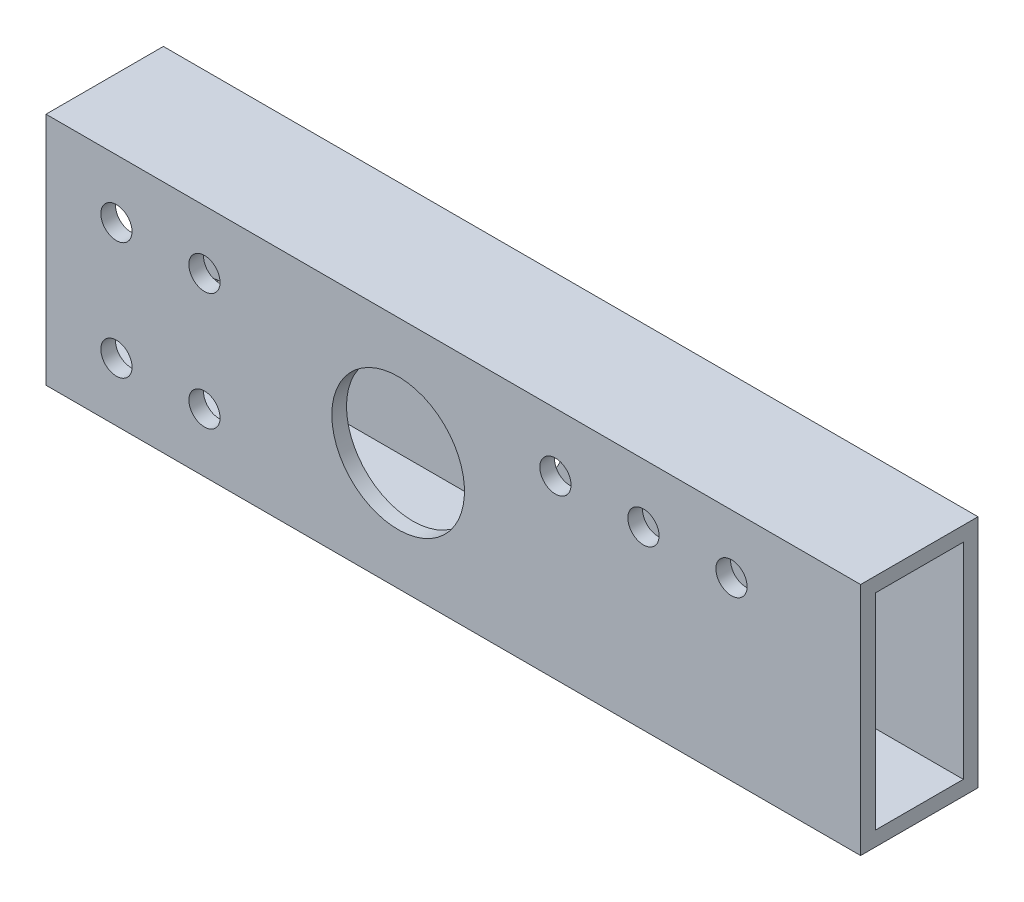
from build123d import *

# Parameters (mm, degrees)
SKETCH1_W           = 176.276
SKETCH1_H           = 25.4
BOSS_EXTRUDE1_DEPTH = 50.8
SKETCH2_OUTSIDE_W   = 64.44
SKETCH2_OUTSIDE_H   = 89.84
SKETCH2_OUTSIDE_W_2 = 25.4
SKETCH2_OUTSIDE_H_2 = 50.8
SKETCH2_OUTSIDE_W_3 = 19.05
SKETCH2_OUTSIDE_H_3 = 44.45
CUT_EXTRUDE1_DEPTH  = 186.199968078
SKETCH3_R           = 14.351
CUT_EXTRUDE2_DEPTH  = 186.199968078
SKETCH4_R           = 3.3782
CUT_EXTRUDE3_DEPTH  = 186.199968078
SKETCH5_R           = 3.3782
CUT_EXTRUDE4_DEPTH  = 186.199968078


with BuildPart() as part:
    # Sketch1 → Boss-Extrude1 (new body)
    with BuildSketch(Plane(origin=(0, 0, 0), x_dir=(1, 0, 0), z_dir=(0, 1, 0))):
        with Locations((88.138, 12.7)):
            Rectangle(SKETCH1_W, SKETCH1_H)
    extrude(amount=BOSS_EXTRUDE1_DEPTH)

    # Sketch2 outside → Cut-Extrude1 (cut, through all)
    # profile 1 of 2: a face of its own
    with BuildSketch(Plane(origin=(176.276, 0, 0), x_dir=(0, 0, -1), z_dir=(1, 0, 0))):
        with Locations((12.7, 25.4)):
            Rectangle(SKETCH2_OUTSIDE_W, SKETCH2_OUTSIDE_H)
        with Locations((12.7, 25.4)):
            Rectangle(SKETCH2_OUTSIDE_W_2, SKETCH2_OUTSIDE_H_2, mode=Mode.SUBTRACT)
    # profile 2 of 2: a face of its own
    with BuildSketch(Plane(origin=(176.276, 0, 0), x_dir=(0, 0, -1), z_dir=(1, 0, 0))):
        with Locations((12.7, 25.4)):
            Rectangle(SKETCH2_OUTSIDE_W_3, SKETCH2_OUTSIDE_H_3)
    extrude(amount=-CUT_EXTRUDE1_DEPTH, mode=Mode.SUBTRACT)

    # Sketch3 → Cut-Extrude2 (cut, through all)
    with BuildSketch(Plane(origin=(0, 0, -25.4), x_dir=(-1, 0, 0), z_dir=(0, 0, -1))):
        with Locations((-76.2, 25.4)):
            Circle(SKETCH3_R)
    extrude(amount=-CUT_EXTRUDE2_DEPTH, mode=Mode.SUBTRACT)

    # Sketch4 → Cut-Extrude3 (cut, through all)
    with BuildSketch(Plane.XY):
        with Locations((148.336, 38.1)):
            Circle(SKETCH4_R)
        with Locations((129.286, 38.1)):
            Circle(SKETCH4_R)
        with Locations((110.236, 38.1)):
            Circle(SKETCH4_R)
    extrude(amount=-CUT_EXTRUDE3_DEPTH, mode=Mode.SUBTRACT)

    # Sketch5 → Cut-Extrude4 (cut, through all)
    with BuildSketch(Plane.XY):
        with Locations((15.24, 38.1)):
            Circle(SKETCH5_R)
        with Locations((15.24, 12.7)):
            Circle(SKETCH5_R)
        with Locations((34.29, 12.7)):
            Circle(SKETCH5_R)
        with Locations((34.29, 38.1)):
            Circle(SKETCH5_R)
    extrude(amount=-CUT_EXTRUDE4_DEPTH, mode=Mode.SUBTRACT)


solid = part.part
